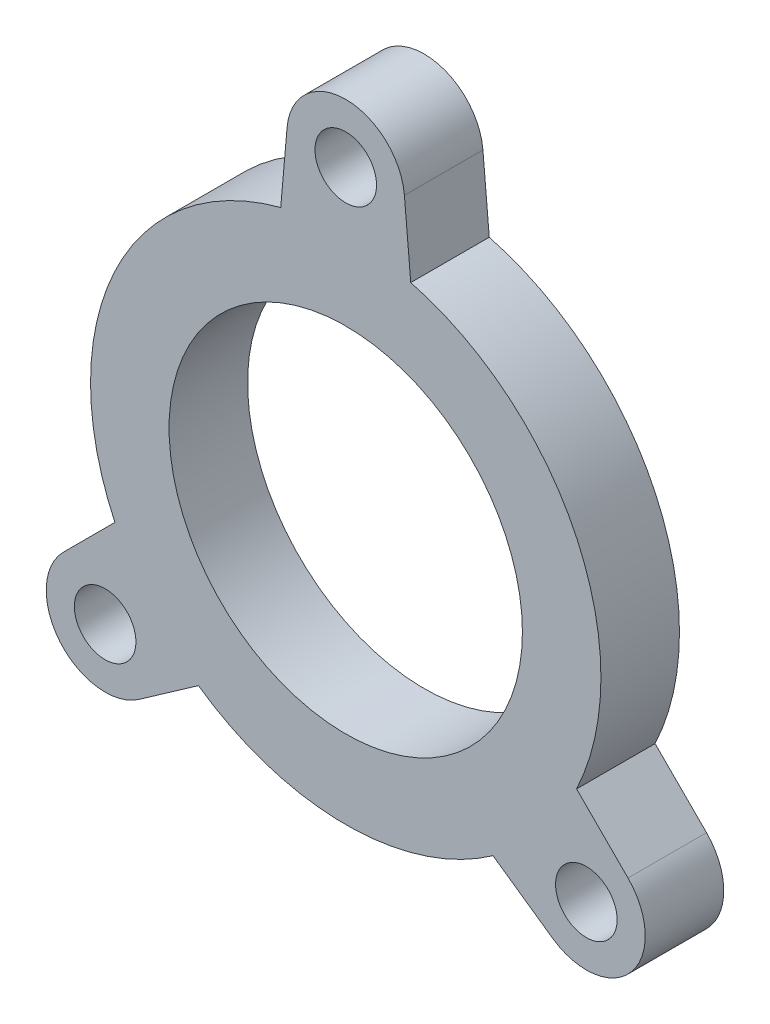
from build123d import *

# Parameters (mm, degrees)
SKETCH1_R           = 2.4892
SKETCH1_R_2         = 14.2875
BOSS_EXTRUDE1_DEPTH = 3.175


with BuildPart() as part:
    # Sketch1 → Boss-Extrude1 (new, symmetric)
    with BuildSketch(Plane.XY):
        with BuildLine():
            Line((-4.74437725, 25.815079225), (-5.256916026, 19.956734205))
            ThreePointArc((-5.256916026, 19.956734205), (-18.703926955, 8.721784377), (-18.666825827, -8.800910167))
            Line((-18.666825827, -8.800910167), (-22.825124901, -12.959209241))
            ThreePointArc((-22.825124901, -12.959209241), (-23.105815516, -19.388081277), (-16.725871077, -20.228016897))
            Line((-16.725871077, -20.228016897), (-11.908664854, -16.854972787))
            ThreePointArc((-11.908664854, -16.854972787), (0, -20.6375), (11.908664854, -16.854972787))
            Line((11.908664854, -16.854972787), (16.725871077, -20.228016897))
            ThreePointArc((16.725871077, -20.228016897), (23.105815516, -19.388081277), (22.825124901, -12.959209241))
            Line((22.825124901, -12.959209241), (18.666825827, -8.800910167))
            ThreePointArc((18.666825827, -8.800910167), (18.703926955, 8.721784377), (5.256916026, 19.956734205))
            Line((5.256916026, 19.956734205), (4.74437725, 25.815079225))
            ThreePointArc((4.74437725, 25.815079225), (0, 30.1625), (-4.74437725, 25.815079225))
        make_face()
        with Locations((0, 25.4)):
            Circle(SKETCH1_R, mode=Mode.SUBTRACT)
        Circle(SKETCH1_R_2, mode=Mode.SUBTRACT)
        with Locations((19.457528855, -16.326805286)):
            Circle(SKETCH1_R, mode=Mode.SUBTRACT)
        with Locations((-19.457528855, -16.326805286)):
            Circle(SKETCH1_R, mode=Mode.SUBTRACT)
    extrude(amount=BOSS_EXTRUDE1_DEPTH, both=True)


solid = part.part
